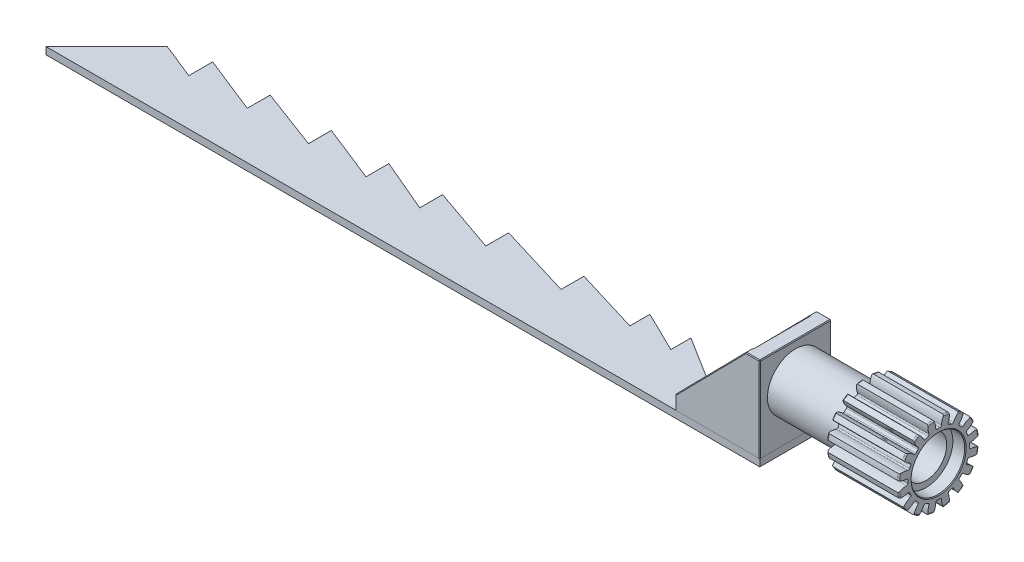
from build123d import *

# Parameters (mm, degrees)
SKETCH12_W               = 25.4
SKETCH12_H               = 12.351
FILLET1_R                = 0.4445
FILLET2_R                = 0.445641616
CIRPATTERN4_COUNT        = 16
FILLET2_OF_CIRPATTERN4_R = 0.445641616
BOSS_EXTRUDE1_START      = -25.4
SKETCH13_R               = 10
BOSS_EXTRUDE1_DEPTH      = 25.4
BOSS_EXTRUDE2_START      = -50.8
SKETCH15_W               = 25.4
SKETCH15_H               = 25.4
BOSS_EXTRUDE2_DEPTH      = 5
BOSS_EXTRUDE3_START      = -50.8
SKETCH15_3_W             = 25.4
SKETCH15_3_H             = 5
BOSS_EXTRUDE3_DEPTH      = 30
RIB1_REACH               = 88.99
SKETCH16_WALL_W          = 211.61871643
SKETCH16_WALL_H          = 2.54
RIB2_START               = -2.54
RIB2_DEPTH               = 2.54
SKETCH18_R               = 7.350000048
CUT_EXTRUDE1_DEPTH       = 84.931230623
SKETCH18_3_R             = 9.525
CUT_EXTRUDE2_DEPTH       = 4.46875
CUT_EXTRUDE3_START       = -43.1
SKETCH18_4_R             = 9.525
CUT_EXTRUDE3_DEPTH       = 12.7
CHAMFER1_SIZE            = 0.26
SKETCH19_W               = 29.48
SKETCH19_H               = 24.88
BOSS_EXTRUDE4_DEPTH      = 2.54
CHAMFER2_SIZE            = 25.4


with BuildPart() as part:
    # Sketch12 → Revolve3 (revolve)
    with BuildSketch(Plane.XY, mode=Mode.PRIVATE) as revolve3_sk:
        with Locations((-12.7, 8.1755)):
            Rectangle(SKETCH12_W, SKETCH12_H)
    revolve(revolve3_sk.sketch.rotate(Axis((0, 0, 0), (1, 0, 0)), 180), axis=Axis((0, 0, 0), (1, 0, 0)))

    # Fillet1
    fillet1_edges = [part.edges().sort_by_distance(p)[0] for p in [
        (-25.4, 14.351, 0),
        (0, 14.351, 0),
    ]]
    fillet(fillet1_edges, radius=FILLET1_R)

    # Cut-Sweep1: sweep along a path in Sketch7
    with BuildLine(Plane.XY) as cut_sweep1_path:
        Line((-25.4, 0), (11.9126, 0))
    # Sketch6 → Cut-Sweep1 (sweep, cut)
    with BuildSketch(Plane(origin=(-25.4, 0, 0), x_dir=(0, 0, -1), z_dir=(-1, 0, 0))):
        with BuildLine():
            Line((-10.90885768, -0.960680225), (-11.779948032, -1.037392132))
            ThreePointArc((-11.779948032, -1.037392132), (-13.053142055, -1.301242785), (-14.231003868, -1.851952997))
            ThreePointArc((-14.231003868, -1.851952997), (-14.351, 0), (-14.231003868, 1.851952997))
            ThreePointArc((-14.231003868, 1.851952997), (-13.053142055, 1.301242785), (-11.779948032, 1.037392132))
            Line((-11.779948032, 1.037392132), (-10.90885768, 0.960680225))
            ThreePointArc((-10.90885768, 0.960680225), (-10.951076768, 0), (-10.90885768, -0.960680225))
        make_face()
    cut_sweep1 = sweep(path=cut_sweep1_path.line, mode=Mode.SUBTRACT)

    # Fillet2
    fillet2_edges = [part.edges().sort_by_distance(p)[0] for p in [
        (-12.7, -0.960680225, 10.90885768),
        (-12.7, 0.960680225, 10.90885768),
    ]]
    fillet(fillet2_edges, radius=FILLET2_R)

    # CirPattern4: Cut-Sweep1 ×16 about axis
    cirpattern4_axis = Axis((-25.4, 0, 0), (1, 0, 0))
    for i in range(1, CIRPATTERN4_COUNT):
        add(cut_sweep1.rotate(cirpattern4_axis, i * 360 / CIRPATTERN4_COUNT), mode=Mode.SUBTRACT)

    # Fillet2 of CirPattern4
    fillet2_of_cirpattern4_edges = [part.edges().sort_by_distance(p)[0] for p in [
        (-12.7, -5.062191897, 9.710833927),
        (-12.7, -3.287086303, 10.446106739),
        (-12.7, -8.393030742, 7.034423739),
        (-12.7, -7.034423739, 8.393030742),
        (-12.7, -10.446106739, 3.287086303),
        (-12.7, -9.710833927, 5.062191897),
        (-12.7, -10.90885768, -0.960680225),
        (-12.7, -10.90885768, 0.960680225),
        (-12.7, -9.710833927, -5.062191897),
        (-12.7, -10.446106739, -3.287086303),
        (-12.7, -7.034423739, -8.393030742),
        (-12.7, -8.393030742, -7.034423739),
        (-12.7, -3.287086303, -10.446106739),
        (-12.7, -5.062191897, -9.710833927),
        (-12.7, 0.960680225, -10.90885768),
        (-12.7, -0.960680225, -10.90885768),
        (-12.7, 5.062191897, -9.710833927),
        (-12.7, 3.287086303, -10.446106739),
        (-12.7, 8.393030742, -7.034423739),
        (-12.7, 7.034423739, -8.393030742),
        (-12.7, 10.446106739, -3.287086303),
        (-12.7, 9.710833927, -5.062191897),
        (-12.7, 10.90885768, 0.960680225),
        (-12.7, 10.90885768, -0.960680225),
        (-12.7, 9.710833927, 5.062191897),
        (-12.7, 10.446106739, 3.287086303),
        (-12.7, 7.034423739, 8.393030742),
        (-12.7, 8.393030742, 7.034423739),
        (-12.7, 3.287086303, 10.446106739),
        (-12.7, 5.062191897, 9.710833927),
    ]]
    fillet(fillet2_of_cirpattern4_edges, radius=FILLET2_OF_CIRPATTERN4_R)

    # Sketch13 → Boss-Extrude1 (add)
    with BuildSketch(Plane(origin=(0, 0, 0), x_dir=(0, 0, -1), z_dir=(1, 0, 0)).offset(BOSS_EXTRUDE1_START)):
        with Locations(Location((0, 0, 0), (0, 0, 90))):
            Circle(SKETCH13_R)
    extrude(amount=-BOSS_EXTRUDE1_DEPTH)

    # Sketch15 → Boss-Extrude2 (add)
    with BuildSketch(Plane(origin=(0, 0, 0), x_dir=(0, 0, -1), z_dir=(1, 0, 0)).offset(BOSS_EXTRUDE2_START)):
        Rectangle(SKETCH15_W, SKETCH15_H)
    extrude(amount=-BOSS_EXTRUDE2_DEPTH)

    # Sketch15<3> → Boss-Extrude3 (add)
    with BuildSketch(Plane(origin=(0, 0, 0), x_dir=(0, 0, -1), z_dir=(1, 0, 0)).offset(BOSS_EXTRUDE3_START)):
        with Locations((0, -15.2)):
            Rectangle(SKETCH15_3_W, SKETCH15_3_H)
    extrude(amount=-BOSS_EXTRUDE3_DEPTH)

    # Sketch16 wall → Rib1 (add, up to next)
    with BuildSketch(Plane(origin=(-68.3, 0, 12.7), x_dir=(0.701472730716, 0.712696294407, 0), z_dir=(-0.712696294407, 0.701472730716, 0)), mode=Mode.PRIVATE) as rib1_sk1:
        with Locations((0, 1.27)):
            Rectangle(SKETCH16_WALL_W, SKETCH16_WALL_H)
    rib1_tool1 = extrude(rib1_sk1.sketch, amount=-RIB1_REACH, mode=Mode.PRIVATE) - part.part
    add(rib1_tool1.solids().sort_by_distance((-68.3, 0, 12.7))[0])

    # Rib2: read off the stored shape, not the designer's step
    # Rib2 outline → Rib2 (add)
    with BuildSketch(Plane(origin=(0, 0, -12.7), x_dir=(-1, 0, 0), z_dir=(0, 0, -1)).offset(RIB2_START)):
        Polygon((80.8, -12.7), (55.8, 12.7), (55.8, -12.7), align=None)
    extrude(amount=RIB2_DEPTH)

    # Sketch18 → Cut-Extrude1 (cut, through all)
    with BuildSketch(Plane(origin=(0, 0, 0), x_dir=(0, 0, -1), z_dir=(1, 0, 0))):
        Circle(SKETCH18_R)
    extrude(amount=-CUT_EXTRUDE1_DEPTH, mode=Mode.SUBTRACT)

    # Sketch18<3> → Cut-Extrude2 (cut)
    with BuildSketch(Plane(origin=(0, 0, 0), x_dir=(0, 0, -1), z_dir=(1, 0, 0))):
        Circle(SKETCH18_3_R)
    extrude(amount=-CUT_EXTRUDE2_DEPTH, mode=Mode.SUBTRACT)

    # Sketch18<4> → Cut-Extrude3 (cut)
    with BuildSketch(Plane(origin=(0, 0, 0), x_dir=(0, 0, -1), z_dir=(1, 0, 0)).offset(CUT_EXTRUDE3_START)):
        Circle(SKETCH18_4_R)
    extrude(amount=-CUT_EXTRUDE3_DEPTH, mode=Mode.SUBTRACT)

    # Chamfer1
    chamfer1_edges = [part.edges().sort_by_distance(p)[0] for p in [
        (-80.8, -17.7, 0),
        (-50.8, -17.7, 0),
        (-53.3, 12.7, -12.7),
        (-68.3, 0, -12.7),
        (-80.8, -15.2, -12.7),
        (-65.8, -17.7, -12.7),
        (-50.8, -2.5, -12.7),
        (-65.8, -17.7, 12.7),
        (-80.8, -15.2, 12.7),
        (-68.3, 0, 12.7),
        (-53.3, 12.7, 12.7),
        (-50.8, -2.5, 12.7),
        (-50.8, 12.7, 0),
        (-80.8, -12.7, 0),
        (-55.8, 12.7, 0),
        (0, 0, 9.525),
        (-55.8, 0, 9.525),
    ]]
    chamfer(chamfer1_edges, length=CHAMFER1_SIZE)

    # Sketch19 → Boss-Extrude4 (add)
    with BuildSketch(Plane.XZ.offset(17.7)):
        Polygon((-80.54, -12.44), (-80.54, 12.44), (-305.06, 12.44), (-305.06, -12.44), (-291.48815809, -12.44), (-270.239366693, -3.98651845), (-270.239366693, -12.44), (-249.827141886, -4.319332684), (-249.827141886, -12.44), (-228.076410534, -4.319332684), (-228.076410534, -12.44), (-207.664185727, -4.319332684), (-207.664185727, -12.44), (-188.590467465, -4.319332684), (-188.590467465, -12.44), (-165.124460417, -4.319332684), (-165.124460417, -12.44), (-138.396472038, -4.319332684), (-138.396472038, -12.44), (-114.972607505, -5.323212593), (-114.972607505, -12.44), (-100.416348831, -5.323212593), (-100.416348831, -12.44), (-85.190836885, -2.916063911), (-85.190836885, -12.44), align=None)
        with Locations((-65.8, 0)):
            Rectangle(SKETCH19_W, SKETCH19_H)
    extrude(amount=BOSS_EXTRUDE4_DEPTH)

    # Chamfer2
    # the kernel refuses this chamfer: 25.4 mm, written as the material it takes off along each edge
    with BuildSketch(Plane(origin=(-305.06, 47.620747894, -12.44), x_dir=(1, 0, 0), z_dir=(0, -1, 0))) as chamfer2_piece_1:
        Polygon((CHAMFER2_SIZE, 0), (0, CHAMFER2_SIZE), (0, 0), align=None)
    extrude(amount=133.181495789, mode=Mode.SUBTRACT)


solid = part.part
